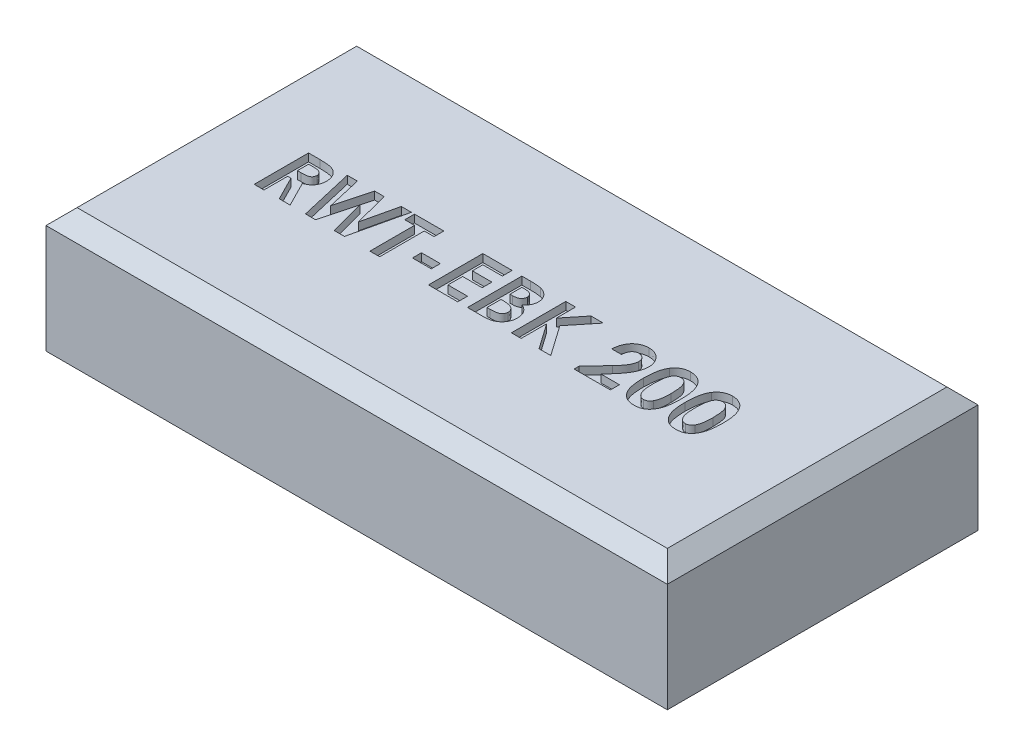
from build123d import *

# Parameters (mm, degrees)
SKETCH1_W           = 40
SKETCH1_H           = 20
BOSS_EXTRUDE1_DEPTH = 8
CHAMFER1_SIZE       = 1
SKETCH4_W           = 1.211538461
SKETCH4_H           = 0.583333333
CUT_EXTRUDE3_DEPTH  = 0.5


with BuildPart() as part:
    # Sketch1 → Boss-Extrude1 (new body)
    with BuildSketch(Plane(origin=(0, 0, 0), x_dir=(1, 0, 0), z_dir=(0, 1, 0))):
        with Locations((0, 2.318501171)):
            Rectangle(SKETCH1_W, SKETCH1_H)
    extrude(amount=BOSS_EXTRUDE1_DEPTH)

    # Chamfer1
    chamfer1_edges = [part.edges().sort_by_distance(p)[0] for p in [
        (0, 8, 7.681498829),
        (-20, 8, -2.318501171),
        (0, 8, -12.318501171),
        (20, 8, -2.318501171),
    ]]
    chamfer(chamfer1_edges, length=CHAMFER1_SIZE)

    # Sketch4 → Cut-Extrude3 (cut)
    # profile 1 of 10: a face of its own
    with BuildSketch(Plane(origin=(0, 8, 0), x_dir=(1, 0, 0), z_dir=(0, 1, 0))):
        with BuildLine():
            Line((-14.596153846, 3.818501171), (-13.864182692, 3.818501171))
            add(Edge.make_bspline(
                [(-13.864182692, 3.818501171), (-13.815799622, 3.818329439), (-13.722745349, 3.81799915), (-13.588566169, 3.81278806), (-13.46530414, 3.805536401), (-13.352776761, 3.794470177), (-13.251032173, 3.779797701), (-13.159968404, 3.76250128), (-13.079588115, 3.742788301), (-13.009213411, 3.718224373), (-12.945703721, 3.690516634), (-12.886503859, 3.658679935), (-12.830307791, 3.623068786), (-12.777491125, 3.582746162), (-12.727594872, 3.538437457), (-12.6805249, 3.49009807), (-12.636946351, 3.437318103), (-12.597129066, 3.380431058), (-12.560838815, 3.320587191), (-12.528765845, 3.257704336), (-12.502684052, 3.191738763), (-12.479637993, 3.123643816), (-12.463038663, 3.052446065), (-12.451494071, 2.978838632), (-12.443041573, 2.902562411), (-12.442555595, 2.850743733), (-12.442307692, 2.824310466)],
                knots=[0, 0, 0, 0, 1.749336639, 3.364467119, 4.854658419, 6.213483162, 7.451590619, 8.570285859, 9.5643256, 10.440900261, 11.26203566, 12.067320669, 12.869050712, 13.665104639, 14.467235401, 15.27997916, 16.102287765, 16.939272006, 17.78853747, 18.631303466, 19.488103222, 20.351255419, 21.228522269, 22.127379805, 23.044756219, 24, 24, 24, 24], degree=3))
            add(Edge.make_bspline(
                [(-12.442307692, 2.824310466), (-12.442951654, 2.796720207), (-12.444214347, 2.742620739), (-12.451015895, 2.663153032), (-12.46344699, 2.587123888), (-12.48227569, 2.514755912), (-12.503916836, 2.4451484), (-12.532694008, 2.379585653), (-12.565171892, 2.317114157), (-12.603744925, 2.258617595), (-12.646076944, 2.20279664), (-12.695308193, 2.151790002), (-12.748249241, 2.102856265), (-12.807876098, 2.059060474), (-12.871560358, 2.017441316), (-12.940567358, 1.979723274), (-13.014446736, 1.944958206), (-13.066387598, 1.925570802), (-13.092948718, 1.91565662)],
                knots=[0, 0, 0, 0, 1.099860209, 2.156625411, 3.176576793, 4.16617041, 5.135385252, 6.078461593, 7.016046972, 7.938469504, 8.868247731, 9.803980173, 10.76021508, 11.73834243, 12.748633912, 13.790971185, 14.870363756, 16, 16, 16, 16], degree=3))
            Line((-13.092948718, 1.91565662), (-12.28525641, 0.318501171))
            Line((-12.28525641, 0.318501171), (-12.983573718, 0.318501171))
            Line((-12.983573718, 0.318501171), (-13.754807692, 1.844142197))
            Line((-13.754807692, 1.844142197), (-13.967948718, 1.844142197))
            Line((-13.967948718, 1.844142197), (-13.967948718, 0.318501171))
            Line((-13.967948718, 0.318501171), (-14.596153846, 0.318501171))
            Line((-14.596153846, 0.318501171), (-14.596153846, 3.818501171))
        make_face()
        with BuildLine():
            Line((-13.967948718, 2.472347325), (-13.723257212, 2.472347325))
            add(Edge.make_bspline(
                [(-13.723257212, 2.472347325), (-13.693341641, 2.472684254), (-13.636059751, 2.473329401), (-13.55368087, 2.476321861), (-13.4788612, 2.483532211), (-13.41127944, 2.492642218), (-13.350595524, 2.503161037), (-13.297350732, 2.518235143), (-13.250724642, 2.534387429), (-13.211269776, 2.554460531), (-13.177560445, 2.577288002), (-13.148454596, 2.603220576), (-13.124379885, 2.633234229), (-13.104565169, 2.666513318), (-13.089151475, 2.70335219), (-13.07790066, 2.743346436), (-13.071613117, 2.786951643), (-13.070889714, 2.817045173), (-13.070512821, 2.832723927)],
                knots=[0, 0, 0, 0, 1.688639943, 3.233382647, 4.650958383, 5.928841754, 7.082724185, 8.122798841, 9.049171256, 9.863274652, 10.613301712, 11.341792392, 12.054588806, 12.776240173, 13.521029143, 14.301969904, 15.115324896, 16, 16, 16, 16], degree=3))
            add(Edge.make_bspline(
                [(-13.070512821, 2.832723927), (-13.071225372, 2.851273039), (-13.072625049, 2.88770933), (-13.086514186, 2.940164814), (-13.108622693, 2.988715953), (-13.1389274, 3.033143381), (-13.177092239, 3.072091531), (-13.220889403, 3.106424636), (-13.27126414, 3.133572687), (-13.317907356, 3.151479252), (-13.36034178, 3.162192934), (-13.398637509, 3.170176676), (-13.442984193, 3.175834983), (-13.493415313, 3.181836624), (-13.549802317, 3.185728385), (-13.612452548, 3.188568594), (-13.681186076, 3.189730664), (-13.729099873, 3.190102157), (-13.754106571, 3.190296043)],
                knots=[0, 0, 0, 0, 1.020303359, 2.004196876, 2.966617323, 3.9489082, 4.950758222, 5.960522915, 7.003732012, 8.091992268, 8.70421221, 9.413913587, 10.24622431, 11.166358409, 12.212345909, 13.359657661, 14.621978493, 16, 16, 16, 16], degree=3))
            Line((-13.754106571, 3.190296043), (-13.967948718, 3.190296043))
            Line((-13.967948718, 3.190296043), (-13.967948718, 2.472347325))
        make_face(mode=Mode.SUBTRACT)
    # profile 2 of 10: a face of its own
    with BuildSketch(Plane(origin=(0, 8, 0), x_dir=(1, 0, 0), z_dir=(0, 1, 0))):
        Polygon((-12.105769231, 3.818501171), (-11.457231571, 3.818501171), (-10.939102564, 1.584026011), (-10.345252404, 3.818501171), (-9.734575321, 3.818501171), (-9.144230769, 1.584026011), (-8.627504006, 3.818501171), (-7.977564103, 3.818501171), (-8.787359776, 0.318501171), (-9.443609776, 0.318501171), (-10.041666667, 2.581021203), (-10.643229167, 0.318501171), (-11.294571314, 0.318501171), align=None)
    # profile 3 of 10: a face of its own
    with BuildSketch(Plane(origin=(0, 8, 0), x_dir=(1, 0, 0), z_dir=(0, 1, 0))):
        Polygon((-7.775641026, 3.818501171), (-5.891025641, 3.818501171), (-5.891025641, 3.190296043), (-6.519230769, 3.190296043), (-6.519230769, 0.318501171), (-7.147435897, 0.318501171), (-7.147435897, 3.190296043), (-7.775641026, 3.190296043), align=None)
    # profile 4 of 10: a face of its own
    with BuildSketch(Plane(origin=(0, 8, 0), x_dir=(1, 0, 0), z_dir=(0, 1, 0))):
        with Locations((-4.791666667, 1.597347325)):
            Rectangle(SKETCH4_W, SKETCH4_H)
    # profile 5 of 10: a face of its own
    with BuildSketch(Plane(origin=(0, 8, 0), x_dir=(1, 0, 0), z_dir=(0, 1, 0))):
        Polygon((-3.378205128, 3.818501171), (-1.493589744, 3.818501171), (-1.493589744, 3.190296043), (-2.75, 3.190296043), (-2.75, 2.51721912), (-1.493589744, 2.51721912), (-1.493589744, 1.889013991), (-2.75, 1.889013991), (-2.75, 0.946706299), (-1.493589744, 0.946706299), (-1.493589744, 0.318501171), (-3.378205128, 0.318501171), align=None)
    # profile 6 of 10: a face of its own
    with BuildSketch(Plane(origin=(0, 8, 0), x_dir=(1, 0, 0), z_dir=(0, 1, 0))):
        with BuildLine():
            Line((-0.865384615, 0.318501171), (-0.865384615, 3.818501171))
            Line((-0.865384615, 3.818501171), (-0.304487179, 3.818501171))
            add(Edge.make_bspline(
                [(-0.304487179, 3.818501171), (-0.265220852, 3.818505652), (-0.189241252, 3.818514323), (-0.079622519, 3.814664873), (0.022039599, 3.809685178), (0.115421572, 3.804114058), (0.200682344, 3.794513904), (0.277692262, 3.784396391), (0.346605192, 3.772195293), (0.389210312, 3.76125053), (0.409254808, 3.756101331)],
                knots=[0, 0, 0, 0, 1.311965854, 2.538629056, 3.664479157, 4.713267157, 5.663616078, 6.530575999, 7.308677837, 8, 8, 8, 8], degree=3))
            add(Edge.make_bspline(
                [(0.409254808, 3.756101331), (0.435575266, 3.748838294), (0.487224455, 3.734585883), (0.561202576, 3.705802524), (0.631381143, 3.673807779), (0.697674471, 3.637307759), (0.759675491, 3.595861807), (0.817148578, 3.549140995), (0.871333285, 3.499020694), (0.920305637, 3.444104065), (0.964568575, 3.386074475), (1.003025131, 3.324947127), (1.03643895, 3.2616567), (1.063178757, 3.195406725), (1.083326699, 3.126502301), (1.09806282, 3.055237661), (1.107613822, 2.981387306), (1.108516267, 2.931144495), (1.108974359, 2.905640594)],
                knots=[0, 0, 0, 0, 1.099996261, 2.158545794, 3.195537121, 4.207578794, 5.205712374, 6.197378256, 7.190519799, 8.17788031, 9.159561366, 10.129234751, 11.085776129, 12.040971148, 13.00380137, 13.975669004, 14.972423361, 16, 16, 16, 16], degree=3))
            add(Edge.make_bspline(
                [(1.108974359, 2.905640594), (1.107776583, 2.872874775), (1.105418909, 2.808379286), (1.090357925, 2.713647082), (1.062116233, 2.624111532), (1.025162666, 2.538122532), (0.974917368, 2.456000819), (0.911115557, 2.377785442), (0.834790614, 2.30106803), (0.776245169, 2.255081117), (0.745793269, 2.231161427)],
                knots=[0, 0, 0, 0, 0.986156485, 1.941127874, 2.875419072, 3.804401753, 4.751181392, 5.761612777, 6.835722519, 8, 8, 8, 8], degree=3))
            add(Edge.make_bspline(
                [(0.745793269, 2.231161427), (0.770470028, 2.218564156), (0.818854324, 2.193864392), (0.887545811, 2.153265354), (0.951146629, 2.110083128), (1.009941945, 2.065186558), (1.062698461, 2.016672412), (1.111594582, 1.967336144), (1.154218027, 1.914350989), (1.192333195, 1.85960544), (1.225462281, 1.802306775), (1.254314061, 1.742551757), (1.278684124, 1.680136252), (1.299321324, 1.615377904), (1.314712554, 1.548053973), (1.324747963, 1.478140383), (1.332431699, 1.405875574), (1.333029422, 1.35665059), (1.333333333, 1.331622165)],
                knots=[0, 0, 0, 0, 1.164658916, 2.283573913, 3.35186032, 4.395461096, 5.390182219, 6.362969632, 7.312859996, 8.245001507, 9.165155236, 10.092416118, 11.032087915, 11.979892451, 12.947605196, 13.931445124, 14.948243989, 16, 16, 16, 16], degree=3))
            add(Edge.make_bspline(
                [(1.333333333, 1.331622165), (1.331361149, 1.283819302), (1.327469051, 1.189480545), (1.29901193, 1.050969584), (1.249676325, 0.91964863), (1.18342878, 0.796039608), (1.101799059, 0.683720797), (1.007948289, 0.585330494), (0.902821331, 0.502045287), (0.805829006, 0.445834233), (0.721938284, 0.40811136), (0.652453165, 0.384788701), (0.577827621, 0.363182624), (0.49669469, 0.348010391), (0.410525202, 0.334123096), (0.318478999, 0.325548791), (0.220728113, 0.319738197), (0.153588579, 0.318921849), (0.118990385, 0.318501171)],
                knots=[0, 0, 0, 0, 1.284142165, 2.534249414, 3.780121997, 5.041676246, 6.291546858, 7.49970053, 8.684500223, 9.883330709, 10.50184324, 11.153274765, 11.851151195, 12.587658647, 13.369265475, 14.195992086, 15.070362669, 16, 16, 16, 16], degree=3))
            Line((0.118990385, 0.318501171), (-0.865384615, 0.318501171))
        make_face()
        with BuildLine():
            Line((-0.237179487, 3.190296043), (-0.237179487, 2.42747553))
            Line((-0.237179487, 2.42747553), (-0.0703125, 2.42747553))
            add(Edge.make_bspline(
                [(-0.0703125, 2.42747553), (-0.047633777, 2.427673297), (-0.003853875, 2.428055074), (0.059381549, 2.432972233), (0.118180282, 2.441361212), (0.172319311, 2.453065948), (0.222302963, 2.467929257), (0.267811927, 2.485813017), (0.308646108, 2.507633149), (0.356085982, 2.540135198), (0.406233349, 2.587963419), (0.450377513, 2.657061193), (0.476378131, 2.736523371), (0.479273899, 2.792566252), (0.480769231, 2.821505979)],
                knots=[0, 0, 0, 0, 1.065314748, 2.056525647, 2.977365736, 3.853934255, 4.656397591, 5.425096493, 6.14721249, 6.826394842, 8.123232004, 9.372140726, 10.643011755, 12, 12, 12, 12], degree=3))
            add(Edge.make_bspline(
                [(0.480769231, 2.821505979), (0.479572691, 2.848612841), (0.47725923, 2.901022871), (0.451079951, 2.97461122), (0.410418355, 3.039825558), (0.362411626, 3.084459439), (0.317203962, 3.114943064), (0.278494386, 3.135015233), (0.236007719, 3.152983634), (0.188921466, 3.166722711), (0.137504514, 3.17703203), (0.082006625, 3.184602991), (0.022332045, 3.189756109), (-0.018885315, 3.190112204), (-0.040164263, 3.190296043)],
                knots=[0, 0, 0, 0, 1.347982417, 2.606269829, 3.849316587, 5.153353503, 5.842674298, 6.568177932, 7.326619318, 8.142485038, 9.012069166, 9.942760135, 10.937925643, 12, 12, 12, 12], degree=3))
            Line((-0.040164263, 3.190296043), (-0.237179487, 3.190296043))
        make_face(mode=Mode.SUBTRACT)
        with BuildLine():
            Line((-0.237179487, 1.844142197), (-0.237179487, 0.946706299))
            Line((-0.237179487, 0.946706299), (-0.056290064, 0.946706299))
            add(Edge.make_bspline(
                [(-0.056290064, 0.946706299), (-0.020527995, 0.946910607), (0.048229046, 0.947303413), (0.146723385, 0.952049449), (0.236279363, 0.960603342), (0.316659689, 0.971282188), (0.387987483, 0.985750355), (0.450021639, 1.004144774), (0.503612874, 1.02438184), (0.548439854, 1.049377018), (0.585060929, 1.078465208), (0.618107609, 1.108194036), (0.645051813, 1.142489048), (0.666370569, 1.179878054), (0.684821916, 1.219432285), (0.695950465, 1.262696318), (0.704423352, 1.308387911), (0.704889637, 1.339991798), (0.705128205, 1.356161427)],
                knots=[0, 0, 0, 0, 1.753078804, 3.370512758, 4.83203934, 6.162291463, 7.344201807, 8.395507345, 9.331626367, 10.147333109, 10.898971645, 11.62040215, 12.321813352, 13.025280112, 13.727906689, 14.453419512, 15.208716525, 16, 16, 16, 16], degree=3))
            add(Edge.make_bspline(
                [(0.705128205, 1.356161427), (0.704602095, 1.374651653), (0.703577374, 1.410665639), (0.695208464, 1.463303922), (0.67999942, 1.512445252), (0.660842888, 1.559346239), (0.634185556, 1.602327663), (0.602504228, 1.642876951), (0.564225095, 1.679620976), (0.521177978, 1.714782156), (0.470967777, 1.745567673), (0.413570936, 1.772279563), (0.348675643, 1.79458835), (0.27608088, 1.81235062), (0.196104895, 1.827425213), (0.108163951, 1.83642641), (0.012990452, 1.843120995), (-0.053004401, 1.843794061), (-0.087139423, 1.844142197)],
                knots=[0, 0, 0, 0, 0.845221588, 1.646264278, 2.427170338, 3.19324141, 3.95557735, 4.731569926, 5.540061037, 6.376114724, 7.268642756, 8.224665384, 9.265483498, 10.400594375, 11.639216012, 12.983232105, 14.439614077, 16, 16, 16, 16], degree=3))
            Line((-0.087139423, 1.844142197), (-0.237179487, 1.844142197))
        make_face(mode=Mode.SUBTRACT)
    # profile 7 of 10: a face of its own
    with BuildSketch(Plane(origin=(0, 8, 0), x_dir=(1, 0, 0), z_dir=(0, 1, 0))):
        Polygon((1.961538462, 3.818501171), (2.58974359, 3.818501171), (2.58974359, 2.586630177), (3.582532051, 3.818501171), (4.375500801, 3.818501171), (3.128205128, 2.270424248), (4.496794872, 0.318501171), (3.740284455, 0.318501171), (2.58974359, 1.959827293), (2.58974359, 0.318501171), (1.961538462, 0.318501171), align=None)
    # profile 8 of 10: a face of its own
    with BuildSketch(Plane(origin=(0, 8, 0), x_dir=(1, 0, 0), z_dir=(0, 1, 0))):
        with BuildLine():
            Line((6.717948718, 2.651834504), (6.08974359, 2.651834504))
            add(Edge.make_bspline(
                [(6.08974359, 2.651834504), (6.092456711, 2.699354899), (6.097757988, 2.792206896), (6.118845127, 2.927077396), (6.147101169, 3.054515188), (6.184812609, 3.174074479), (6.232199501, 3.285711827), (6.288042457, 3.389807809), (6.353768139, 3.485814357), (6.427977688, 3.573268474), (6.50941123, 3.65172437), (6.596378125, 3.721288296), (6.690208648, 3.778690696), (6.789188439, 3.825927558), (6.893300645, 3.863667615), (7.003530329, 3.888899897), (7.118923064, 3.905987446), (7.197918735, 3.907482675), (7.23818109, 3.908244761)],
                knots=[0, 0, 0, 0, 1.199038563, 2.342849363, 3.436047546, 4.486744587, 5.497670872, 6.488682221, 7.459191391, 8.424610317, 9.374430501, 10.305433194, 11.225809216, 12.140057399, 13.06607119, 14.010487599, 14.985989317, 16, 16, 16, 16], degree=3))
            add(Edge.make_bspline(
                [(7.23818109, 3.908244761), (7.287602559, 3.906702681), (7.38408485, 3.903692179), (7.52428127, 3.878011599), (7.655209399, 3.835056862), (7.776774062, 3.775037765), (7.88794036, 3.698789794), (7.988689856, 3.607876567), (8.075975727, 3.500390678), (8.15035139, 3.380804438), (8.212148677, 3.254179441), (8.255453641, 3.123243943), (8.283917528, 2.991472441), (8.286953378, 2.902744181), (8.288461538, 2.858665434)],
                knots=[0, 0, 0, 0, 1.075374347, 2.099382735, 3.09057751, 4.06680945, 5.040638231, 6.016817125, 7.011024321, 8.044445721, 9.0776792, 10.070479129, 11.0414456, 12, 12, 12, 12], degree=3))
            add(Edge.make_bspline(
                [(8.288461538, 2.858665434), (8.28787434, 2.832003492), (8.286692456, 2.778339588), (8.278474655, 2.697132932), (8.26614633, 2.614414458), (8.24755822, 2.53025509), (8.224377324, 2.444631236), (8.196255546, 2.357286655), (8.162540574, 2.268716557), (8.123795042, 2.177924102), (8.077571525, 2.084614522), (8.023750665, 1.98738907), (7.960903933, 1.886333992), (7.889790439, 1.7808787), (7.810064803, 1.671189511), (7.721337829, 1.557596844), (7.624631444, 1.439700436), (7.555996202, 1.360893303), (7.520733173, 1.320404216)],
                knots=[0, 0, 0, 0, 0.728284026, 1.46585585, 2.227944881, 3.01186502, 3.81876927, 4.650621989, 5.517437689, 6.406905708, 7.346299482, 8.360816762, 9.441613733, 10.596154504, 11.834900912, 13.145207542, 14.533280747, 16, 16, 16, 16], degree=3))
            Line((7.520733173, 1.320404216), (7.155448718, 0.901834504))
            Line((7.155448718, 0.901834504), (8.333333333, 0.901834504))
            Line((8.333333333, 0.901834504), (8.333333333, 0.318501171))
            Line((8.333333333, 0.318501171), (6, 0.318501171))
            Line((6, 0.318501171), (6, 0.636810466))
            Line((6, 0.636810466), (7.036258013, 1.739675049))
            add(Edge.make_bspline(
                [(7.036258013, 1.739675049), (7.066260345, 1.771845952), (7.124365966, 1.834151449), (7.207044276, 1.9256537), (7.281860843, 2.012487153), (7.347264285, 2.095576408), (7.40668689, 2.172226387), (7.457479009, 2.244747418), (7.50010535, 2.312483883), (7.546382289, 2.39416223), (7.590330169, 2.491578193), (7.630655009, 2.603805377), (7.655235789, 2.711068718), (7.658628714, 2.780963817), (7.66025641, 2.814494761)],
                knots=[0, 0, 0, 0, 1.246127091, 2.413378631, 3.493388633, 4.492180848, 5.408488754, 6.240484944, 6.999099869, 7.674939598, 8.898438119, 10.020720584, 11.050475521, 12, 12, 12, 12], degree=3))
            add(Edge.make_bspline(
                [(7.66025641, 2.814494761), (7.659039421, 2.846933362), (7.65668131, 2.909788353), (7.630767577, 2.999199244), (7.590621122, 3.080151677), (7.534049098, 3.150226705), (7.465522659, 3.207812002), (7.386333921, 3.250642327), (7.297128506, 3.275355229), (7.234593811, 3.278448401), (7.202423878, 3.280039632)],
                knots=[0, 0, 0, 0, 1.062038974, 2.057870785, 3.028805853, 4.01125022, 4.991535629, 5.949134679, 6.94496649, 8, 8, 8, 8], degree=3))
            add(Edge.make_bspline(
                [(7.202423878, 3.280039632), (7.185804481, 3.279451813), (7.153086529, 3.278294595), (7.104993697, 3.27059131), (7.059229913, 3.257015074), (7.015285799, 3.238824829), (6.973630338, 3.214713529), (6.9343686, 3.184992509), (6.897086913, 3.15041705), (6.861956264, 3.111095263), (6.829982787, 3.067212138), (6.801584062, 3.019168456), (6.778103044, 2.966994041), (6.757429502, 2.911377673), (6.741485078, 2.851721988), (6.729875559, 2.788384019), (6.721049617, 2.721466807), (6.719001154, 2.675467517), (6.717948718, 2.651834504)],
                knots=[0, 0, 0, 0, 0.903469896, 1.778625579, 2.63899355, 3.493148037, 4.358286772, 5.247621495, 6.164656832, 7.118446693, 8.109501108, 9.111810964, 10.146451449, 11.215617525, 12.33435995, 13.498009769, 14.714554818, 16, 16, 16, 16], degree=3))
        make_face()
    # profile 9 of 10: a face of its own
    with BuildSketch(Plane(origin=(0, 8, 0), x_dir=(1, 0, 0), z_dir=(0, 1, 0))):
        with BuildLine():
            add(Edge.make_bspline(
                [(9.915765224, 3.908244761), (9.94617296, 3.907793349), (10.005962692, 3.906905754), (10.094021714, 3.897292372), (10.178846898, 3.882769234), (10.260770092, 3.86251452), (10.339201605, 3.835708128), (10.414712276, 3.803621336), (10.48640331, 3.764571127), (10.555188998, 3.720461909), (10.621042843, 3.670524021), (10.682382094, 3.613592251), (10.740326935, 3.550976601), (10.793623075, 3.481730434), (10.843450772, 3.406483618), (10.889646302, 3.325224221), (10.931856026, 3.237554532), (10.970553014, 3.143316345), (11.005155982, 3.04109707), (11.03430202, 2.929724208), (11.059299625, 2.809172324), (11.080399367, 2.679141347), (11.096347361, 2.539458435), (11.107096631, 2.390216385), (11.114473288, 2.231702915), (11.115075319, 2.122963977), (11.115384615, 2.067098927)],
                knots=[0, 0, 0, 0, 0.879237366, 1.728815576, 2.559023295, 3.367336655, 4.166867292, 4.954216142, 5.737608147, 6.525189134, 7.316157332, 8.124696809, 8.942788509, 9.781158001, 10.649253743, 11.551476218, 12.482711956, 13.461909668, 14.496590415, 15.601789533, 16.789733467, 18.056700938, 19.410929216, 20.8549011, 22.384193279, 24, 24, 24, 24], degree=3))
            add(Edge.make_bspline(
                [(11.115384615, 2.067098927), (11.11505035, 2.010534943), (11.114400879, 1.900632136), (11.10740328, 1.740668821), (11.095353086, 1.590343185), (11.079821925, 1.449670779), (11.058548484, 1.31872589), (11.033634327, 1.19716946), (11.004028228, 1.085045549), (10.968285448, 0.982606796), (10.929822694, 0.888203106), (10.887497509, 0.800704352), (10.842047614, 0.71987354), (10.794515494, 0.644491226), (10.742295263, 0.576779642), (10.687928626, 0.514436242), (10.629048363, 0.459835764), (10.568133562, 0.410164346), (10.502952665, 0.367238273), (10.434177868, 0.329695837), (10.360583034, 0.299244462), (10.283509672, 0.272759483), (10.201644051, 0.253746125), (10.116287005, 0.238659651), (10.026474869, 0.23032194), (9.96532715, 0.229287592), (9.933994391, 0.228757581)],
                knots=[0, 0, 0, 0, 1.643780988, 3.193836972, 4.651895693, 6.025988579, 7.305620092, 8.505800249, 9.631074763, 10.672816429, 11.65661981, 12.592235626, 13.49536222, 14.350718032, 15.179365177, 15.97804903, 16.751647189, 17.51006938, 18.259804725, 19.016521909, 19.783502495, 20.571750527, 21.382245291, 22.22305063, 23.089471752, 24, 24, 24, 24], degree=3))
            add(Edge.make_bspline(
                [(9.933994391, 0.228757581), (9.902662478, 0.229297816), (9.841283721, 0.230356128), (9.751228725, 0.238597657), (9.665419329, 0.253807241), (9.58290602, 0.272905453), (9.504263076, 0.299185861), (9.429113408, 0.330548319), (9.358034851, 0.367856509), (9.2908306, 0.410882596), (9.227730109, 0.460221675), (9.167752798, 0.515346009), (9.111031339, 0.576115872), (9.058428606, 0.643211936), (9.00908312, 0.71573861), (8.963509474, 0.794524112), (8.921735059, 0.879453732), (8.882453162, 0.970645855), (8.848322166, 1.070063741), (8.817947164, 1.17859518), (8.793064761, 1.297144871), (8.773052668, 1.425674728), (8.757075024, 1.563912456), (8.745189494, 1.711924777), (8.738153027, 1.869780633), (8.737510367, 1.978282826), (8.737179487, 2.034146203)],
                knots=[0, 0, 0, 0, 0.917216111, 1.796812873, 2.643793957, 3.46689424, 4.273913431, 5.068098542, 5.848489301, 6.620921603, 7.401012384, 8.190319798, 9.003608147, 9.831726257, 10.68377682, 11.569763213, 12.493818149, 13.453288342, 14.474581811, 15.568529029, 16.750744269, 18.018426408, 19.375425659, 20.823733699, 22.36466933, 24, 24, 24, 24], degree=3))
            add(Edge.make_bspline(
                [(8.737179487, 2.034146203), (8.737778845, 2.111763968), (8.738935314, 2.261528446), (8.753590934, 2.477894573), (8.775101668, 2.677887577), (8.80669584, 2.861172919), (8.845761597, 3.028429436), (8.895787333, 3.178555327), (8.952737994, 3.313627923), (9.001267274, 3.393645742), (9.024639423, 3.432183062)],
                knots=[0, 0, 0, 0, 1.288568992, 2.486310467, 3.599230591, 4.627010532, 5.572937695, 6.447898582, 7.252493626, 8, 8, 8, 8], degree=3))
            add(Edge.make_bspline(
                [(9.024639423, 3.432183062), (9.051815445, 3.470042113), (9.104949923, 3.544064019), (9.197857043, 3.641240945), (9.297673647, 3.72435141), (9.406449911, 3.791514551), (9.522465493, 3.844479409), (9.646716447, 3.881887892), (9.778743933, 3.903683818), (9.869409411, 3.906701743), (9.915765224, 3.908244761)],
                knots=[0, 0, 0, 0, 1.058512271, 2.069600068, 3.047294572, 4.004278952, 4.967380941, 5.939006123, 6.946246673, 8, 8, 8, 8], degree=3))
        make_face()
        with BuildLine():
            add(Edge.make_bspline(
                [(9.931189904, 3.280039632), (9.903701059, 3.278736716), (9.84980833, 3.276182308), (9.771607414, 3.254498986), (9.697868832, 3.221007927), (9.641777862, 3.180706674), (9.599794329, 3.142073089), (9.570460134, 3.107110952), (9.542171926, 3.068095726), (9.517186356, 3.023266856), (9.493593455, 2.974235095), (9.47053608, 2.920777869), (9.451635087, 2.861582152), (9.433065363, 2.797656056), (9.416796552, 2.727232193), (9.403166854, 2.649734927), (9.390989918, 2.564660285), (9.382496359, 2.471952543), (9.374577814, 2.371708697), (9.368901426, 2.263705442), (9.36652827, 2.147971914), (9.365773916, 2.068267952), (9.365384615, 2.027134985)],
                knots=[0, 0, 0, 0, 1.076674018, 2.110852608, 3.161083442, 4.239746716, 4.804137807, 5.395870207, 6.026861976, 6.692161227, 7.405688833, 8.16177676, 8.973626916, 9.841385931, 10.773283133, 11.807421078, 12.927755683, 14.143907515, 15.458935494, 16.872852025, 18.386167141, 20, 20, 20, 20], degree=3))
            add(Edge.make_bspline(
                [(9.365384615, 2.027134985), (9.366025357, 1.973845238), (9.367254027, 1.871658197), (9.373689226, 1.724709674), (9.386588049, 1.590974686), (9.40263158, 1.46954686), (9.425165374, 1.361213689), (9.451091964, 1.264950241), (9.483108996, 1.181983641), (9.520110846, 1.111114005), (9.561092062, 1.050825352), (9.605578975, 0.999579726), (9.652056964, 0.955203432), (9.70197676, 0.919157115), (9.755219267, 0.891532879), (9.81134001, 0.871663107), (9.870374652, 0.859499993), (9.910800967, 0.85781336), (9.931189904, 0.856962709)],
                knots=[0, 0, 0, 0, 1.771748488, 3.397459088, 4.888034009, 6.237357457, 7.467047327, 8.564189669, 9.548206622, 10.417051504, 11.216568818, 11.965764335, 12.669334354, 13.348544111, 14.005342236, 14.656555988, 15.322436492, 16, 16, 16, 16], degree=3))
            add(Edge.make_bspline(
                [(9.931189904, 0.856962709), (9.950879157, 0.857544788), (9.989428267, 0.858684424), (10.045641503, 0.87038264), (10.098800732, 0.889401398), (10.148745452, 0.916304766), (10.195654308, 0.950516515), (10.239298036, 0.992186986), (10.279347487, 1.041731537), (10.302680478, 1.07850092), (10.314703526, 1.097447485)],
                knots=[0, 0, 0, 0, 0.992283464, 1.942767638, 2.88273346, 3.832339453, 4.79467288, 5.803907806, 6.868395428, 8, 8, 8, 8], degree=3))
            add(Edge.make_bspline(
                [(10.314703526, 1.097447485), (10.328858639, 1.12333736), (10.358540763, 1.177626329), (10.392888969, 1.269236938), (10.421801373, 1.372558565), (10.446685858, 1.487912756), (10.463705327, 1.615754481), (10.478362473, 1.755273086), (10.485431979, 1.907171129), (10.486581872, 2.012406641), (10.487179487, 2.067098927)],
                knots=[0, 0, 0, 0, 0.710965849, 1.490837728, 2.352621235, 3.297892224, 4.334225155, 5.461620853, 6.680770821, 8, 8, 8, 8], degree=3))
            add(Edge.make_bspline(
                [(10.487179487, 2.067098927), (10.486948641, 2.122265969), (10.486504303, 2.228453106), (10.478351976, 2.380897234), (10.466999238, 2.520129644), (10.450393459, 2.645839487), (10.429027107, 2.758331932), (10.402692997, 2.857599625), (10.37164704, 2.943838204), (10.334830235, 3.016961676), (10.294053336, 3.079106596), (10.250767413, 3.132422118), (10.204789436, 3.177941565), (10.156196294, 3.215836235), (10.103863282, 3.244790606), (10.04879003, 3.265234787), (9.990863632, 3.27760283), (9.951349628, 3.279216402), (9.931189904, 3.280039632)],
                knots=[0, 0, 0, 0, 1.793836731, 3.452829483, 4.963243077, 6.335886805, 7.574563692, 8.684454726, 9.672768357, 10.54971625, 11.340229787, 12.085688095, 12.778991901, 13.440269426, 14.083255152, 14.715733572, 15.344777694, 16, 16, 16, 16], degree=3))
        make_face(mode=Mode.SUBTRACT)
    # profile 10 of 10: a face of its own
    with BuildSketch(Plane(origin=(0, 8, 0), x_dir=(1, 0, 0), z_dir=(0, 1, 0))):
        with BuildLine():
            add(Edge.make_bspline(
                [(12.608072917, 3.908244761), (12.638480652, 3.907793349), (12.698270385, 3.906905754), (12.786329406, 3.897292372), (12.871154591, 3.882769234), (12.953077785, 3.86251452), (13.031509297, 3.835708128), (13.107019968, 3.803621336), (13.178711003, 3.764571127), (13.247496691, 3.720461909), (13.313350535, 3.670524021), (13.374689786, 3.613592251), (13.432634627, 3.550976601), (13.485930767, 3.481730434), (13.535758465, 3.406483618), (13.581953994, 3.325224221), (13.624163718, 3.237554532), (13.662860706, 3.143316345), (13.697463675, 3.04109707), (13.726609713, 2.929724208), (13.751607317, 2.809172324), (13.772707059, 2.679141347), (13.788655053, 2.539458435), (13.799404323, 2.390216385), (13.80678098, 2.231702915), (13.807383012, 2.122963977), (13.807692308, 2.067098927)],
                knots=[0, 0, 0, 0, 0.879237366, 1.728815576, 2.559023295, 3.367336655, 4.166867292, 4.954216142, 5.737608147, 6.525189134, 7.316157332, 8.124696809, 8.942788509, 9.781158001, 10.649253743, 11.551476218, 12.482711956, 13.461909668, 14.496590415, 15.601789533, 16.789733467, 18.056700938, 19.410929216, 20.8549011, 22.384193279, 24, 24, 24, 24], degree=3))
            add(Edge.make_bspline(
                [(13.807692308, 2.067098927), (13.807358042, 2.010534943), (13.806708571, 1.900632136), (13.799710973, 1.740668821), (13.787660778, 1.590343185), (13.772129618, 1.449670779), (13.750856176, 1.31872589), (13.725942019, 1.19716946), (13.69633592, 1.085045549), (13.660593141, 0.982606796), (13.622130387, 0.888203106), (13.579805201, 0.800704352), (13.534355307, 0.71987354), (13.486823186, 0.644491226), (13.434602955, 0.576779642), (13.380236318, 0.514436242), (13.321356056, 0.459835764), (13.260441254, 0.410164346), (13.195260358, 0.367238273), (13.12648556, 0.329695837), (13.052890726, 0.299244462), (12.975817364, 0.272759483), (12.893951743, 0.253746125), (12.808594697, 0.238659651), (12.718782561, 0.23032194), (12.657634842, 0.229287592), (12.626302083, 0.228757581)],
                knots=[0, 0, 0, 0, 1.643780988, 3.193836972, 4.651895693, 6.025988579, 7.305620092, 8.505800249, 9.631074763, 10.672816429, 11.65661981, 12.592235626, 13.49536222, 14.350718032, 15.179365177, 15.97804903, 16.751647189, 17.51006938, 18.259804725, 19.016521909, 19.783502495, 20.571750527, 21.382245291, 22.22305063, 23.089471752, 24, 24, 24, 24], degree=3))
            add(Edge.make_bspline(
                [(12.626302083, 0.228757581), (12.59497017, 0.229297816), (12.533591414, 0.230356128), (12.443536417, 0.238597657), (12.357727022, 0.253807241), (12.275213712, 0.272905453), (12.196570768, 0.299185861), (12.1214211, 0.330548319), (12.050342543, 0.367856509), (11.983138292, 0.410882596), (11.920037802, 0.460221675), (11.86006049, 0.515346009), (11.803339031, 0.576115872), (11.750736299, 0.643211936), (11.701390812, 0.71573861), (11.655817167, 0.794524112), (11.614042751, 0.879453732), (11.574760854, 0.970645855), (11.540629858, 1.070063741), (11.510254856, 1.17859518), (11.485372454, 1.297144871), (11.46536036, 1.425674728), (11.449382717, 1.563912456), (11.437497186, 1.711924777), (11.43046072, 1.869780633), (11.429818059, 1.978282826), (11.429487179, 2.034146203)],
                knots=[0, 0, 0, 0, 0.917216111, 1.796812873, 2.643793957, 3.46689424, 4.273913431, 5.068098542, 5.848489301, 6.620921603, 7.401012384, 8.190319798, 9.003608147, 9.831726257, 10.68377682, 11.569763213, 12.493818149, 13.453288342, 14.474581811, 15.568529029, 16.750744269, 18.018426408, 19.375425659, 20.823733699, 22.36466933, 24, 24, 24, 24], degree=3))
            add(Edge.make_bspline(
                [(11.429487179, 2.034146203), (11.430086537, 2.111763968), (11.431243006, 2.261528446), (11.445898626, 2.477894573), (11.46740936, 2.677887577), (11.499003532, 2.861172919), (11.538069289, 3.028429436), (11.588095025, 3.178555327), (11.645045686, 3.313627923), (11.693574966, 3.393645742), (11.716947115, 3.432183062)],
                knots=[0, 0, 0, 0, 1.288568992, 2.486310467, 3.599230591, 4.627010532, 5.572937695, 6.447898582, 7.252493626, 8, 8, 8, 8], degree=3))
            add(Edge.make_bspline(
                [(11.716947115, 3.432183062), (11.744123137, 3.470042113), (11.797257615, 3.544064019), (11.890164735, 3.641240945), (11.989981339, 3.72435141), (12.098757603, 3.791514551), (12.214773185, 3.844479409), (12.339024139, 3.881887892), (12.471051626, 3.903683818), (12.561717103, 3.906701743), (12.608072917, 3.908244761)],
                knots=[0, 0, 0, 0, 1.058512271, 2.069600068, 3.047294572, 4.004278952, 4.967380941, 5.939006123, 6.946246673, 8, 8, 8, 8], degree=3))
        make_face()
        with BuildLine():
            add(Edge.make_bspline(
                [(12.623497596, 3.280039632), (12.596008751, 3.278736716), (12.542116023, 3.276182308), (12.463915106, 3.254498986), (12.390176524, 3.221007927), (12.334085555, 3.180706674), (12.292102022, 3.142073089), (12.262767826, 3.107110952), (12.234479618, 3.068095726), (12.209494048, 3.023266856), (12.185901148, 2.974235095), (12.162843773, 2.920777869), (12.14394278, 2.861582152), (12.125373055, 2.797656056), (12.109104244, 2.727232193), (12.095474546, 2.649734927), (12.08329761, 2.564660285), (12.074804052, 2.471952543), (12.066885506, 2.371708697), (12.061209118, 2.263705442), (12.058835962, 2.147971914), (12.058081608, 2.068267952), (12.057692308, 2.027134985)],
                knots=[0, 0, 0, 0, 1.076674018, 2.110852608, 3.161083442, 4.239746716, 4.804137807, 5.395870207, 6.026861976, 6.692161227, 7.405688833, 8.16177676, 8.973626916, 9.841385931, 10.773283133, 11.807421078, 12.927755683, 14.143907515, 15.458935494, 16.872852025, 18.386167141, 20, 20, 20, 20], degree=3))
            add(Edge.make_bspline(
                [(12.057692308, 2.027134985), (12.05833305, 1.973845238), (12.05956172, 1.871658197), (12.065996919, 1.724709674), (12.078895741, 1.590974686), (12.094939272, 1.46954686), (12.117473067, 1.361213689), (12.143399656, 1.264950241), (12.175416688, 1.181983641), (12.212418538, 1.111114005), (12.253399754, 1.050825352), (12.297886667, 0.999579726), (12.344364656, 0.955203432), (12.394284452, 0.919157115), (12.44752696, 0.891532879), (12.503647703, 0.871663107), (12.562682345, 0.859499993), (12.603108659, 0.85781336), (12.623497596, 0.856962709)],
                knots=[0, 0, 0, 0, 1.771748488, 3.397459088, 4.888034009, 6.237357457, 7.467047327, 8.564189669, 9.548206622, 10.417051504, 11.216568818, 11.965764335, 12.669334354, 13.348544111, 14.005342236, 14.656555988, 15.322436492, 16, 16, 16, 16], degree=3))
            add(Edge.make_bspline(
                [(12.623497596, 0.856962709), (12.64318685, 0.857544788), (12.681735959, 0.858684424), (12.737949195, 0.87038264), (12.791108425, 0.889401398), (12.841053145, 0.916304766), (12.887962, 0.950516515), (12.931605729, 0.992186986), (12.971655179, 1.041731537), (12.994988171, 1.07850092), (13.007011218, 1.097447485)],
                knots=[0, 0, 0, 0, 0.992283464, 1.942767638, 2.88273346, 3.832339453, 4.79467288, 5.803907806, 6.868395428, 8, 8, 8, 8], degree=3))
            add(Edge.make_bspline(
                [(13.007011218, 1.097447485), (13.021166331, 1.12333736), (13.050848455, 1.177626329), (13.085196661, 1.269236938), (13.114109066, 1.372558565), (13.13899355, 1.487912756), (13.156013019, 1.615754481), (13.170670165, 1.755273086), (13.177739671, 1.907171129), (13.178889565, 2.012406641), (13.179487179, 2.067098927)],
                knots=[0, 0, 0, 0, 0.710965849, 1.490837728, 2.352621235, 3.297892224, 4.334225155, 5.461620853, 6.680770821, 8, 8, 8, 8], degree=3))
            add(Edge.make_bspline(
                [(13.179487179, 2.067098927), (13.179256334, 2.122265969), (13.178811995, 2.228453106), (13.170659668, 2.380897234), (13.15930693, 2.520129644), (13.142701151, 2.645839487), (13.121334799, 2.758331932), (13.095000689, 2.857599625), (13.063954732, 2.943838204), (13.027137927, 3.016961676), (12.986361029, 3.079106596), (12.943075106, 3.132422118), (12.897097128, 3.177941565), (12.848503986, 3.215836235), (12.796170975, 3.244790606), (12.741097722, 3.265234787), (12.683171324, 3.27760283), (12.64365732, 3.279216402), (12.623497596, 3.280039632)],
                knots=[0, 0, 0, 0, 1.793836731, 3.452829483, 4.963243077, 6.335886805, 7.574563692, 8.684454726, 9.672768357, 10.54971625, 11.340229787, 12.085688095, 12.778991901, 13.440269426, 14.083255152, 14.715733572, 15.344777694, 16, 16, 16, 16], degree=3))
        make_face(mode=Mode.SUBTRACT)
    extrude(amount=-CUT_EXTRUDE3_DEPTH, mode=Mode.SUBTRACT)


solid = part.part
